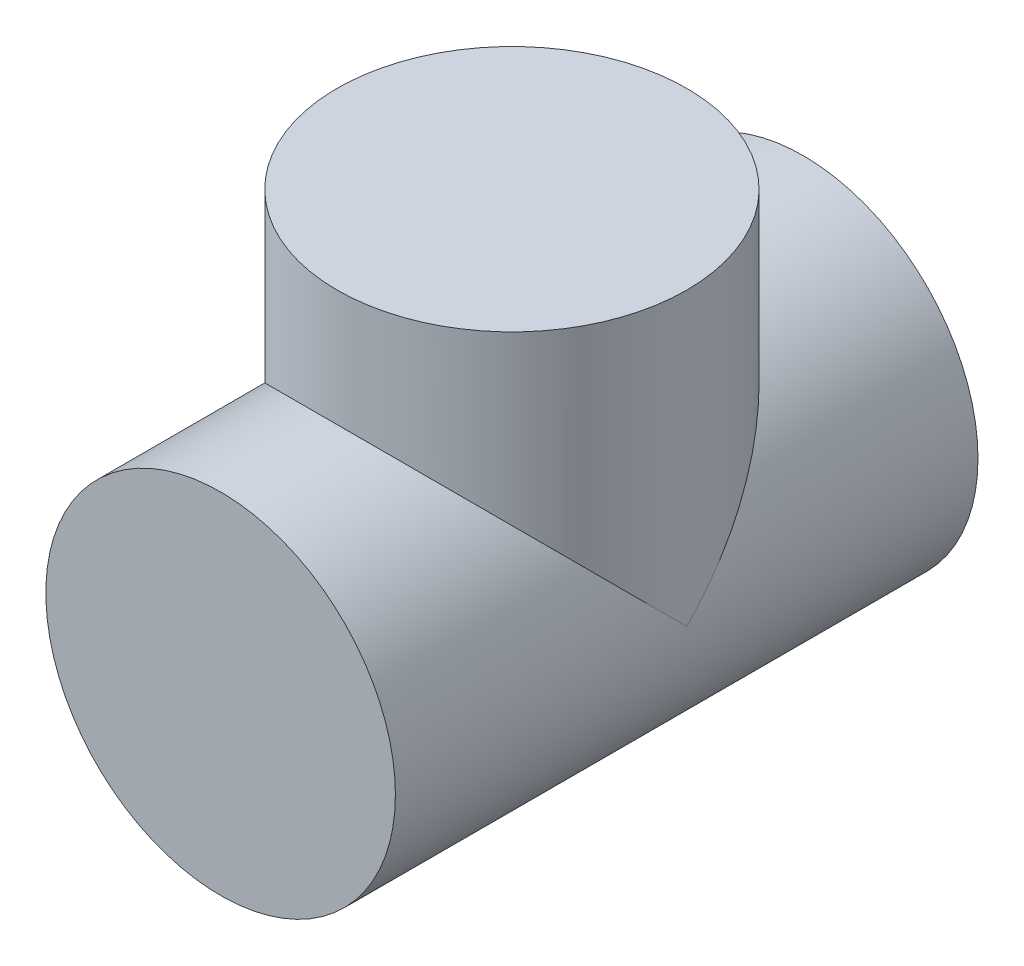
from build123d import *

# Parameters (mm, degrees)
SKETCH1_R           = 7.62
BOSS_EXTRUDE1_DEPTH = 25.4
BOSS_EXTRUDE2_DEPTH = 12.7


with BuildPart() as part:
    # Sketch1 → Boss-Extrude1 (new body)
    with BuildSketch(Plane.XY):
        Circle(SKETCH1_R)
    extrude(amount=BOSS_EXTRUDE1_DEPTH)

    # Sketch2 → Boss-Extrude2 (add)
    with BuildSketch(Plane(origin=(0, 0, 0), x_dir=(1, 0, 0), z_dir=(0, 1, 0))):
        with BuildLine():
            ThreePointArc((0, -5.08), (-5.388153673, -18.088153673), (7.62, -12.7))
            ThreePointArc((7.62, -12.7), (5.388153673, -7.311846327), (0, -5.08))
        make_face()
    extrude(amount=BOSS_EXTRUDE2_DEPTH)


solid = part.part
